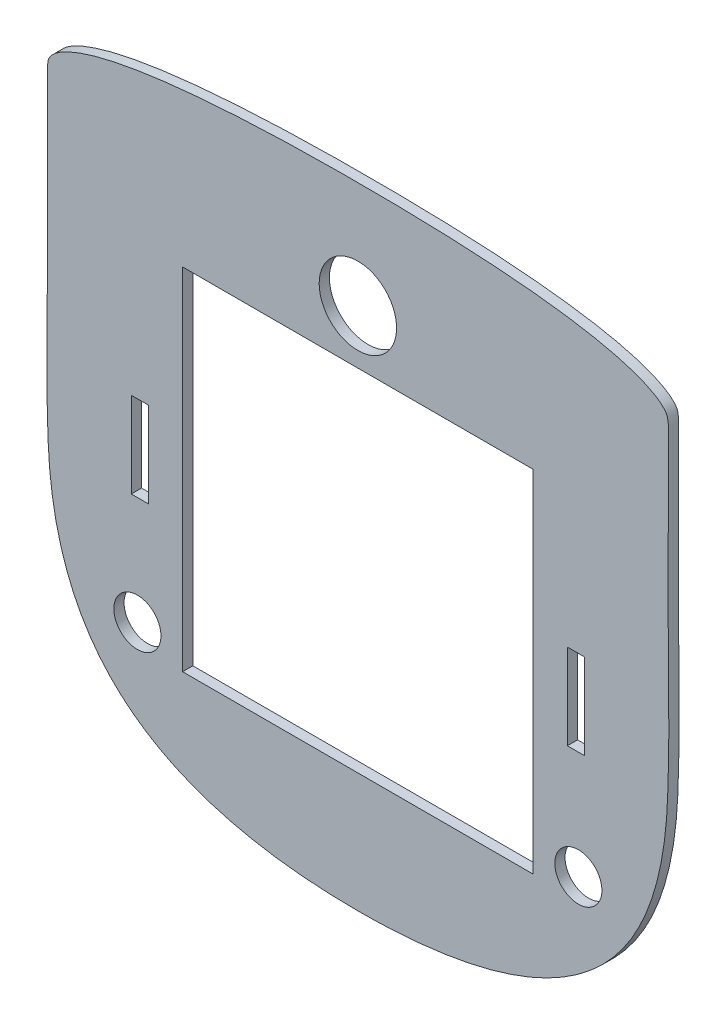
from build123d import *

# Parameters (mm, degrees)
SKETCH2_R           = 7
SKETCH2_W           = 5.08
SKETCH2_H           = 25.4
SKETCH2_R_2         = 11.5
BOSS_EXTRUDE1_DEPTH = 3.048
CUT_EXTRUDE1_DEPTH  = 41.402


with BuildPart() as part:
    # Sketch2 → Boss-Extrude1 (new body)
    with BuildSketch(Plane(origin=(-0.201743714, -72.235465767, -2871.297081617), x_dir=(1, 0, 0), z_dir=(0, 0, 1))):
        with BuildLine():
            add(Edge.make_bspline(
                [(98.004062475, 101.157461169), (98.09262319, 100.582578169), (98.168282436, 99.850726468), (98.201035971, 98.964297447), (98.205576946, 98.520375047), (98.203312676, 98.076151584), (98.2036357, 97.631790351), (98.202558859, 97.187198741), (98.201774618, 96.594166212), (98.199727801, 95.555659629), (98.196350571, 94.070122586), (98.191219577, 92.28435558), (98.185300348, 90.49549016), (98.178622099, 88.703544032), (98.171344138, 86.908538509), (98.163557432, 85.110493402), (98.155396592, 83.309431675), (98.146977163, 81.505376018), (98.135573428, 79.096007637), (98.121287428, 76.076928858), (98.105071958, 72.442435741), (98.090760178, 68.796539176), (98.079583302, 65.139438492), (98.072772264, 61.471337421), (98.071088324, 57.79245144), (98.075293125, 54.103000287), (98.087402852, 50.403265868), (98.10943536, 46.693533793), (98.149097734, 41.734317266), (98.212450561, 35.511894369), (98.259787617, 28.010008132), (98.250221769, 21.731245728), (98.193919112, 16.694316231), (98.134491312, 13.540940961), (98.069931219, 11.015367159), (98.012479287, 9.119948631), (97.944993251, 7.223485327), (97.867530353, 5.326182094), (97.778046924, 3.42822235), (97.678623521, 1.529831063), (97.562359374, -0.368849117), (97.273887049, -4.165889382), (96.636661612, -9.85760728), (95.264266353, -17.392207333), (93.283204663, -24.816906824), (90.614186019, -32.040137569), (87.187668119, -38.958467556), (83.676565473, -44.359852554), (80.486245723, -48.402543782), (77.054491026, -52.240907458), (72.331970353, -56.627334171), (66.103033739, -61.188185381), (59.428677872, -65.046681648), (52.43241755, -68.244481021), (45.195675565, -70.831968561), (37.797306155, -72.863270501), (30.289713623, -74.393153681), (22.727531896, -75.494270646), (12.612681112, -76.462699086), (5.032383013, -76.714841356), (-5.035467708, -76.714845104), (-12.619786852, -76.462418803), (-22.738781506, -75.493068818), (-30.303459175, -74.391002905), (-37.812929796, -72.859918013), (-45.212549357, -70.8271864), (-52.449882097, -68.238039152), (-59.446050161, -65.038426839), (-66.11960737, -61.178042376), (-72.347079086, -56.615416709), (-77.067892297, -52.227754271), (-80.498089265, -48.388656373), (-83.686768813, -44.345422026), (-87.195743233, -38.943757554), (-90.61986046, -32.025747475), (-93.286817212, -24.803397784), (-95.266250936, -17.379993897), (-96.637448669, -9.846957631), (-97.274071314, -4.156518411), (-97.562243264, -0.360344948), (-97.678371151, 1.537899747), (-97.777873142, 3.435856699), (-97.867367387, 5.333384926), (-97.944866703, 7.230259477), (-98.01237118, 9.126297729), (-98.069845849, 11.021295221), (-98.134428193, 13.546313761), (-98.193879205, 16.699007643), (-98.250205894, 21.73487995), (-98.259784562, 28.01239372), (-98.21244762, 35.512930688), (-98.149088971, 41.734380411), (-98.109425083, 46.69292327), (-98.087392785, 50.402205892), (-98.075284257, 54.10154993), (-98.071081296, 57.790672769), (-98.072767321, 61.469295328), (-98.079580473, 65.137200586), (-98.090759277, 68.794175587), (-98.10507262, 72.440018947), (-98.121289158, 76.074533479), (-98.135575612, 79.093693997), (-98.146979553, 81.503167019), (-98.155398915, 83.307320997), (-98.163559853, 85.108501066), (-98.171346036, 86.906684767), (-98.178624384, 88.70184922), (-98.185301078, 90.493974969), (-98.19122227, 92.28304054), (-98.196348387, 94.069029013), (-98.19973362, 95.554767419), (-98.201767603, 96.593425349), (-98.202574021, 97.186545216), (-98.203601448, 97.631207844), (-98.203365989, 98.075631059), (-98.205614022, 98.519942912), (-98.200956032, 98.963909964), (-98.168457073, 99.850519984), (-98.092668955, 100.58248079), (-97.911826163, 101.756705998), (-97.591091313, 102.927189457), (-96.744501402, 104.523718023), (-95.628370708, 105.930697933), (-94.324169919, 107.14983424), (-92.908919976, 108.210412347), (-90.919547633, 109.448243636), (-88.32196599, 110.731146164), (-85.128922247, 111.980994275), (-81.907009003, 113.019085815), (-78.679652448, 113.899326262), (-75.458556986, 114.656106392), (-72.248323156, 115.314989419), (-69.051267541, 115.893006101), (-65.867703019, 116.403620435), (-62.697382089, 116.855995394), (-59.54006886, 117.258606965), (-55.346025805, 117.736366707), (-50.130480964, 118.237811213), (-43.904887694, 118.718293109), (-37.698280921, 119.100136152), (-31.497185994, 119.401363035), (-25.286074462, 119.631882756), (-19.049652571, 119.802550798), (-10.6782592, 119.95730558), (-4.311359032, 120), (4.311566967, 120), (10.678373272, 119.957301971), (19.049194344, 119.802559271), (25.285019509, 119.631912924), (31.495423882, 119.401431783), (37.695748902, 119.100264796), (43.901569172, 118.718504865), (50.126405995, 118.238134551), (55.341386835, 117.736807508), (59.535046852, 117.259158056), (62.692115597, 116.856637797), (65.862243647, 116.404363117), (69.04567768, 115.893856369), (72.242677523, 115.315956677), (75.452943985, 114.657195729), (78.674177119, 113.900542139), (81.901794523, 113.020426463), (85.124114848, 111.98245115), (88.317738818, 110.73269729), (90.915977188, 109.449832), (92.905995487, 108.211972862), (94.321790196, 107.151328604), (95.626592976, 105.93205679), (96.74337158, 104.52484085), (97.59061533, 102.927904772), (97.911707231, 101.756975983), (98.004062475, 101.157461169)],
                knots=[0, 0, 0, 0, 0.00256774, 0.003209675, 0.00385161, 0.004493545, 0.00513548, 0.005777415, 0.00641935, 0.00770322, 0.010270959, 0.012838699, 0.015406439, 0.017974179, 0.020541919, 0.023109659, 0.025677399, 0.028245138, 0.030812878, 0.035948358, 0.041083838, 0.046219318, 0.051354797, 0.056490277, 0.061625757, 0.066761236, 0.071896716, 0.077032196, 0.082167676, 0.092438635, 0.102709594, 0.112980554, 0.118116034, 0.123251513, 0.125819253, 0.128386993, 0.130954733, 0.133522473, 0.136090213, 0.138657953, 0.141225692, 0.143793432, 0.154064392, 0.164335351, 0.174606311, 0.18487727, 0.19514823, 0.205419189, 0.210554669, 0.215690148, 0.225961108, 0.236232067, 0.246503027, 0.256773986, 0.267044946, 0.277315905, 0.287586865, 0.297857824, 0.308128783, 0.328670702, 0.328670702, 0.349206929, 0.359475043, 0.369743156, 0.38001127, 0.390279383, 0.400547497, 0.41081561, 0.421083724, 0.431351837, 0.441619951, 0.446754008, 0.451888064, 0.462156178, 0.472424291, 0.482692405, 0.492960518, 0.503228632, 0.513496745, 0.516063774, 0.518630802, 0.521197831, 0.523764859, 0.526331887, 0.528898916, 0.531465944, 0.534032972, 0.539167029, 0.544301086, 0.554569199, 0.564837313, 0.575105426, 0.580239483, 0.58537354, 0.590507597, 0.595641653, 0.60077571, 0.605909767, 0.611043824, 0.61617788, 0.621311937, 0.626445994, 0.629013022, 0.631580051, 0.634147079, 0.636714107, 0.639281136, 0.641848164, 0.644415193, 0.646982221, 0.649549249, 0.650832764, 0.651474521, 0.652116278, 0.652758035, 0.653399792, 0.654041549, 0.654683306, 0.657250335, 0.657250335, 0.659928039, 0.662605744, 0.665283448, 0.667961153, 0.670638857, 0.673316562, 0.678671971, 0.68402738, 0.68938279, 0.694738199, 0.700093608, 0.705449017, 0.710804426, 0.716159836, 0.721515245, 0.726870654, 0.732226063, 0.742936882, 0.7536477, 0.764358518, 0.775069337, 0.785780155, 0.796490973, 0.807201792, 0.828623429, 0.828623429, 0.8500455, 0.860756536, 0.871467571, 0.882178607, 0.892889643, 0.903600679, 0.914311714, 0.92502275, 0.930378268, 0.935733786, 0.941089304, 0.946444821, 0.951800339, 0.957155857, 0.962511375, 0.967866893, 0.973222411, 0.978577929, 0.983933446, 0.986611205, 0.989288964, 0.991966723, 0.994644482, 0.997322241, 1, 1, 1, 1], degree=3))
        make_face()
        with Locations((-65.5, -30.887752409)):
            Circle(SKETCH2_R, mode=Mode.SUBTRACT)
        with Locations((-64.77000195, 13.912247591)):
            Rectangle(SKETCH2_W, SKETCH2_H, mode=Mode.SUBTRACT)
        Polygon((0, 67.252247902), (52.07, 67.252248214), (52.070001625, -36.887752409), (-52.07000195, -36.887752409), (-52.07000195, 67.252247591), align=None, mode=Mode.SUBTRACT)
        with Locations((65.5, -30.887752409)):
            Circle(SKETCH2_R, mode=Mode.SUBTRACT)
        with Locations((64.77000195, 13.912247591)):
            Rectangle(SKETCH2_W, SKETCH2_H, mode=Mode.SUBTRACT)
        with Locations((0, 83.287247591)):
            Circle(SKETCH2_R_2, mode=Mode.SUBTRACT)
    extrude(amount=BOSS_EXTRUDE1_DEPTH)

    # Sketch8 → Cut-Extrude1 (cut)
    with BuildSketch(Plane(origin=(0, 0, -2871.297081617), x_dir=(-1, 0, 0), z_dir=(0, 0, -1))):
        with BuildLine():
            add(Edge.make_bspline(
                [(-97.802318762, 28.921995402), (-97.890879476, 28.347112402), (-97.966538722, 27.615260701), (-97.999292258, 26.72883168), (-98.003833232, 26.28490928), (-98.001568962, 25.840685818), (-98.001891986, 25.396324584), (-98.000815145, 24.951732974), (-98.000030904, 24.358700446), (-97.997984087, 23.320193862), (-97.994606857, 21.834656819), (-97.989475863, 20.048889814), (-97.983556634, 18.260024394), (-97.976878385, 16.468078265), (-97.969600424, 14.673072742), (-97.961813718, 12.875027636), (-97.953652879, 11.073965908), (-97.945233449, 9.269910252), (-97.933829714, 6.860541871), (-97.919543714, 3.841463091), (-97.903328244, 0.206969974), (-97.889016464, -3.438926591), (-97.877839588, -7.096027275), (-97.87102855, -10.764128346), (-97.86934461, -14.443014327), (-97.873549411, -18.13246548), (-97.885659138, -21.832199899), (-97.907691646, -25.541931973), (-97.947354021, -30.501148501), (-98.010706847, -36.723571398), (-98.058043903, -44.225457635), (-98.048478055, -50.504220038), (-97.992175398, -55.541149536), (-97.932747598, -58.694524805), (-97.868187505, -61.220098607), (-97.810735573, -63.115517135), (-97.743249537, -65.01198044), (-97.665786639, -66.909283673), (-97.57630321, -68.807243416), (-97.476879807, -70.705634704), (-97.36061566, -72.604314884), (-97.072143335, -76.401355149), (-96.434917898, -82.093073046), (-95.062522639, -89.6276731), (-93.08146095, -97.052372591), (-90.412442305, -104.275603335), (-86.985924405, -111.193933323), (-83.474821759, -116.595318321), (-80.284502009, -120.638009549), (-76.852747312, -124.476373225), (-72.130226639, -128.862799937), (-65.901290026, -133.423651148), (-59.226934158, -137.282147414), (-52.230673836, -140.479946788), (-44.993931851, -143.067434327), (-37.595562441, -145.098736268), (-30.087969909, -146.628619448), (-22.525788182, -147.729736413), (-12.410937398, -148.698164853), (-4.830639299, -148.950307123), (5.237211422, -148.950310871), (12.821530566, -148.697884569), (22.94052522, -147.728534585), (30.505202888, -146.626468672), (38.01467351, -145.09538378), (45.414293071, -143.062652167), (52.651625811, -140.473504918), (59.647793875, -137.273892606), (66.321351084, -133.413508142), (72.5488228, -128.850882476), (77.269636011, -124.463220038), (80.699832979, -120.624122139), (83.888512527, -116.580887793), (87.397486947, -111.17922332), (90.821604174, -104.261213242), (93.488560926, -97.038863551), (95.46799465, -89.615459663), (96.839192383, -82.082423398), (97.475815028, -76.391984177), (97.763986978, -72.595810715), (97.880114865, -70.69756602), (97.979616856, -68.799609067), (98.069111101, -66.902080841), (98.146610416, -65.00520629), (98.214114894, -63.109168038), (98.271589563, -61.214170545), (98.336171907, -58.689152006), (98.395622919, -55.536458124), (98.451949608, -50.500585817), (98.461528276, -44.223072047), (98.414191334, -36.722535078), (98.350832684, -30.501085356), (98.311168797, -25.542542497), (98.289136499, -21.833259874), (98.277027971, -18.133915836), (98.27282501, -14.444792997), (98.274511034, -10.766170439), (98.281324187, -7.09826518), (98.292502991, -3.44129018), (98.306816334, 0.20455318), (98.323032872, 3.839067712), (98.337319326, 6.85822823), (98.348723267, 9.267701252), (98.357142629, 11.07185523), (98.365303567, 12.873035299), (98.37308975, 14.671219), (98.380368097, 16.466383454), (98.387044792, 18.258509202), (98.392965984, 20.047574773), (98.398092101, 21.833563247), (98.401477334, 23.319301652), (98.403511317, 24.357959583), (98.404317734, 24.951079449), (98.405345162, 25.395742077), (98.405109703, 25.840165292), (98.407357735, 26.284477146), (98.402699746, 26.728444197), (98.370200787, 27.615054217), (98.294412669, 28.347015023), (98.113569876, 29.521240231), (97.792835026, 30.69172369), (96.946245115, 32.288252256), (95.830114422, 33.695232166), (94.525913633, 34.914368473), (93.11066369, 35.974946581), (91.121291347, 37.21277787), (88.523709704, 38.495680397), (85.330665961, 39.745528508), (82.108752716, 40.783620049), (78.881396161, 41.663860496), (75.6603007, 42.420640625), (72.45006687, 43.079523652), (69.253011254, 43.657540334), (66.069446732, 44.168154669), (62.899125803, 44.620529627), (59.741812573, 45.023141198), (55.547769519, 45.50090094), (50.332224678, 46.002345447), (44.106631408, 46.482827342), (37.900024635, 46.864670385), (31.698929708, 47.165897269), (25.487818176, 47.39641699), (19.251396285, 47.567085031), (10.880002913, 47.721839814), (4.513102746, 47.764534233), (-4.109823253, 47.764534233), (-10.476629559, 47.721836204), (-18.84745063, 47.567093504), (-25.083275795, 47.396447158), (-31.293680168, 47.165966016), (-37.494005188, 46.864799029), (-43.699825458, 46.483039098), (-49.924662281, 46.002668784), (-55.139643121, 45.501341742), (-59.333303138, 45.02369229), (-62.490371883, 44.62117203), (-65.660499933, 44.16889735), (-68.843933966, 43.658390602), (-72.040933809, 43.08049091), (-75.251200271, 42.421729962), (-78.472433405, 41.665076372), (-81.700050809, 40.784960696), (-84.922371134, 39.746985383), (-88.115995104, 38.497231523), (-90.714233474, 37.214366233), (-92.704251774, 35.976507095), (-94.120046482, 34.915862837), (-95.424849262, 33.696591023), (-96.541627866, 32.289375083), (-97.388871616, 30.692439005), (-97.709963517, 29.521510216), (-97.802318762, 28.921995402)],
                knots=[0, 0, 0, 0, 0.00256774, 0.003209675, 0.00385161, 0.004493545, 0.00513548, 0.005777415, 0.00641935, 0.00770322, 0.010270959, 0.012838699, 0.015406439, 0.017974179, 0.020541919, 0.023109659, 0.025677399, 0.028245138, 0.030812878, 0.035948358, 0.041083838, 0.046219318, 0.051354797, 0.056490277, 0.061625757, 0.066761236, 0.071896716, 0.077032196, 0.082167676, 0.092438635, 0.102709594, 0.112980554, 0.118116034, 0.123251513, 0.125819253, 0.128386993, 0.130954733, 0.133522473, 0.136090213, 0.138657953, 0.141225692, 0.143793432, 0.154064392, 0.164335351, 0.174606311, 0.18487727, 0.19514823, 0.205419189, 0.210554669, 0.215690148, 0.225961108, 0.236232067, 0.246503027, 0.256773986, 0.267044946, 0.277315905, 0.287586865, 0.297857824, 0.308128783, 0.328670702, 0.328670702, 0.349206929, 0.359475043, 0.369743156, 0.38001127, 0.390279383, 0.400547497, 0.41081561, 0.421083724, 0.431351837, 0.441619951, 0.446754008, 0.451888064, 0.462156178, 0.472424291, 0.482692405, 0.492960518, 0.503228632, 0.513496745, 0.516063774, 0.518630802, 0.521197831, 0.523764859, 0.526331887, 0.528898916, 0.531465944, 0.534032972, 0.539167029, 0.544301086, 0.554569199, 0.564837313, 0.575105426, 0.580239483, 0.58537354, 0.590507597, 0.595641653, 0.60077571, 0.605909767, 0.611043824, 0.61617788, 0.621311937, 0.626445994, 0.629013022, 0.631580051, 0.634147079, 0.636714107, 0.639281136, 0.641848164, 0.644415193, 0.646982221, 0.649549249, 0.650832764, 0.651474521, 0.652116278, 0.652758035, 0.653399792, 0.654041549, 0.654683306, 0.657250335, 0.657250335, 0.659928039, 0.662605744, 0.665283448, 0.667961153, 0.670638857, 0.673316562, 0.678671971, 0.68402738, 0.68938279, 0.694738199, 0.700093608, 0.705449017, 0.710804426, 0.716159836, 0.721515245, 0.726870654, 0.732226063, 0.742936882, 0.7536477, 0.764358518, 0.775069337, 0.785780155, 0.796490973, 0.807201792, 0.828623429, 0.828623429, 0.8500455, 0.860756536, 0.871467571, 0.882178607, 0.892889643, 0.903600679, 0.914311714, 0.92502275, 0.930378268, 0.935733786, 0.941089304, 0.946444821, 0.951800339, 0.957155857, 0.962511375, 0.967866893, 0.973222411, 0.978577929, 0.983933446, 0.986611205, 0.989288964, 0.991966723, 0.994644482, 0.997322241, 1, 1, 1, 1], degree=3))
        make_face()
        with BuildLine():
            add(Edge.make_bspline(
                [(0.201743522, -144.623319731), (-3.274536304, -144.623319865), (-6.738547743, -144.537415239), (-13.639117858, -144.17337837), (-17.075885232, -143.896707457), (-23.917176856, -143.117595306), (-27.321713607, -142.615241598), (-34.091569015, -141.335924274), (-37.456790771, -140.558282134), (-42.467583889, -139.132463684), (-44.131958582, -138.613639953), (-47.445143032, -137.476320327), (-49.079136574, -136.862852677), (-53.907042783, -134.875577699), (-57.027450589, -133.356027639), (-61.530249164, -130.724141208), (-63.001395544, -129.787786199), (-65.157935979, -128.283760343), (-65.868579212, -127.765607018), (-67.258794227, -126.705614731), (-67.940144477, -126.162576337), (-71.27754047, -123.381633721), (-73.725197711, -120.946171591), (-77.049028104, -116.96339166), (-78.099695644, -115.581499232), (-79.589134787, -113.426597328), (-80.072068485, -112.693245508), (-81.004897857, -111.205414168), (-81.453226985, -110.453556275), (-83.607344907, -106.655829248), (-85.05323229, -103.495825112), (-86.875348272, -98.603559912), (-87.424591436, -96.947277726), (-88.168216421, -94.427617375), (-88.402634024, -93.581952361), (-88.843052793, -91.891169187), (-89.049511593, -91.044543362), (-90.017851718, -86.805673806), (-90.589625027, -83.396366179), (-91.214815991, -78.261538564), (-91.3840958, -76.546418242), (-91.654496844, -73.110059757), (-91.754016272, -71.388677816), (-91.898041054, -67.94097593), (-91.953937652, -66.21567845), (-92.047124571, -62.763413411), (-92.082532425, -61.036276883), (-92.216452156, -52.396723879), (-92.18174868, -45.471992609), (-92.088776017, -35.090783444), (-92.050582828, -31.630433758), (-91.989104785, -24.709623916), (-91.967343228, -21.249135437), (-91.935387884, -10.86768894), (-91.950845684, -3.946701754), (-91.989167962, 6.434762218), (-92.005223842, 9.895238506), (-92.030335068, 16.816216046), (-92.042022057, 20.276707913), (-92.052491789, 24.169770815), (-92.053737389, 24.602325411), (-92.055319228, 25.251182986), (-92.056417151, 25.467506003), (-92.057189797, 25.900059362), (-92.057095442, 26.116304741), (-92.02698149, 26.763098356), (-91.978779879, 27.19246262), (-91.889344649, 27.727267604), (-91.870064381, 27.83414662), (-91.828925375, 28.047701464), (-91.808160197, 28.154405584), (-91.726988406, 28.467446667), (-91.65227417, 28.66842382), (-91.468917245, 29.057668114), (-91.359394128, 29.247447264), (-91.11804123, 29.606368595), (-90.986480026, 29.776462145), (-90.568248072, 30.266477752), (-90.256757384, 30.567894605), (-89.601419654, 31.129549974), (-89.259792729, 31.387452268), (-88.557956958, 31.872737011), (-88.197767155, 32.100150737), (-87.096730457, 32.748775452), (-86.335064825, 33.135792743), (-84.777268278, 33.853219879), (-83.986925551, 34.179530259), (-81.601253499, 35.088514112), (-79.986643693, 35.603747797), (-76.729369531, 36.528837706), (-75.086341974, 36.937329685), (-71.780252186, 37.679060145), (-70.117182339, 38.012270017), (-66.776153116, 38.622762265), (-65.097074445, 38.899741463), (-61.737301209, 39.407885048), (-60.055411866, 39.639429545), (-55.004811485, 40.27858234), (-51.631273297, 40.631893297), (-44.8751476, 41.236725519), (-41.492474378, 41.487282667), (-31.334002379, 42.121382869), (-24.544052969, 42.389307732), (-10.974643961, 42.717803017), (-4.192330738, 42.777909329), (9.368637658, 42.738812197), (16.147215028, 42.636220411), (29.699167251, 42.204464881), (36.472601324, 41.877880212), (46.62672232, 41.125389049), (50.010405342, 40.829964018), (56.775001058, 40.118464923), (60.149502258, 39.703179825), (66.874429576, 38.697267592), (70.226685679, 38.108245128), (75.205795664, 37.005329061), (76.859061013, 36.599674154), (80.133291379, 35.682509559), (81.75724986, 35.171544533), (84.146014914, 34.277014131), (84.933113097, 33.957970061), (86.481394857, 33.260825802), (87.244594757, 32.883160796), (88.72406713, 32.039193106), (89.437776152, 31.578598492), (90.431586847, 30.773845288), (90.748830719, 30.486610048), (91.184220302, 30.020992011), (91.322848846, 29.859654122), (91.582701428, 29.520562866), (91.703496358, 29.342864518), (91.914884307, 28.975434703), (92.006759063, 28.784977768), (92.118252687, 28.486452265), (92.151015114, 28.38479609), (92.206584763, 28.17662686), (92.227506651, 28.071891945), (92.329344448, 27.548669314), (92.39159565, 27.128973088), (92.443543455, 26.497018498), (92.45523748, 26.286039897), (92.462017015, 25.863116448), (92.460346666, 25.651360338), (92.458083199, 25.016251853), (92.457289977, 24.592887837), (92.45093913, 22.475929022), (92.445997129, 20.782404301), (92.429509702, 15.701769956), (92.417556107, 12.314683849), (92.389510302, 5.540526499), (92.375801061, 2.153443402), (92.345673384, -8.00778177), (92.340360666, -14.781904332), (92.393318139, -24.942974536), (92.423417891, -28.32997472), (92.490213033, -35.103962787), (92.525899349, -38.491049624), (92.599380118, -48.650942063), (92.605139835, -55.422441517), (92.423350701, -63.879111689), (92.37698766, -65.57003786), (92.261788465, -68.950974084), (92.19632998, -70.641121827), (91.893906299, -75.707241991), (91.568112557, -79.079593307), (90.837153692, -84.128244194), (90.552935949, -85.809474195), (89.891323681, -89.168135838), (89.515906538, -90.834550134), (88.244354253, -95.779057782), (87.202473146, -99.007446467), (85.285940995, -103.726254701), (84.587996215, -105.278509513), (83.44261575, -107.572436225), (83.043626428, -108.332733268), (82.214469653, -109.834639411), (81.785650062, -110.57381334), (79.570074017, -114.210562237), (77.570688207, -116.932267832), (74.224079389, -120.727378139), (73.04987121, -121.943886373), (71.201237497, -123.696423665), (70.570511353, -124.268597235), (69.280049641, -125.388950185), (68.618635142, -125.938410226), (65.262197027, -128.607702982), (62.426605155, -130.48902916), (57.983597367, -132.990734487), (56.471068344, -133.771385502), (54.158695701, -134.868753278), (53.380631714, -135.222257654), (51.810471978, -135.905565591), (51.018390834, -136.23530376), (47.049358743, -137.817468481), (43.826477644, -138.880572429), (37.306563581, -140.691491332), (34.009381997, -141.438674363), (27.353837442, -142.672901073), (23.995657139, -143.16072145), (18.919984401, -143.729167953), (17.220737046, -143.891322706), (13.822843435, -144.164632358), (12.122727142, -144.276152944), (8.720321786, -144.452497738), (7.018028553, -144.517232289), (4.463051204, -144.581290722), (3.185178094, -144.605057776), (1.693674208, -144.618775071), (0.94776185, -144.622186153), (0.628051025, -144.622915154), (0.414902926, -144.62323894), (0.310377266, -144.623319727), (0.201743522, -144.623319731)],
                knots=[0, 0, 0, 0, 0.015625, 0.015625, 0.03125, 0.03125, 0.046875, 0.046875, 0.0625, 0.0625, 0.0703125, 0.0703125, 0.078125, 0.078125, 0.09375, 0.09375, 0.1015625, 0.1015625, 0.10546875, 0.10546875, 0.109375, 0.109375, 0.125, 0.125, 0.1328125, 0.1328125, 0.13671875, 0.13671875, 0.140625, 0.140625, 0.15625, 0.15625, 0.1640625, 0.1640625, 0.16796875, 0.16796875, 0.171875, 0.171875, 0.1875, 0.1875, 0.1953125, 0.1953125, 0.203125, 0.203125, 0.2109375, 0.2109375, 0.21875, 0.21875, 0.25, 0.25, 0.265625, 0.265625, 0.28125, 0.28125, 0.3125, 0.3125, 0.328125, 0.328125, 0.34375, 0.34375, 0.345703125, 0.345703125, 0.346679688, 0.346679688, 0.34765625, 0.34765625, 0.349609375, 0.349609375, 0.350097656, 0.350097656, 0.350585938, 0.350585938, 0.3515625, 0.3515625, 0.352539062, 0.352539062, 0.353515625, 0.353515625, 0.35546875, 0.35546875, 0.357421875, 0.357421875, 0.359375, 0.359375, 0.36328125, 0.36328125, 0.3671875, 0.3671875, 0.375, 0.375, 0.3828125, 0.3828125, 0.390625, 0.390625, 0.3984375, 0.3984375, 0.40625, 0.40625, 0.421875, 0.421875, 0.4375, 0.4375, 0.46875, 0.46875, 0.5, 0.5, 0.53125, 0.53125, 0.5625, 0.5625, 0.578125, 0.578125, 0.59375, 0.59375, 0.609375, 0.609375, 0.6171875, 0.6171875, 0.625, 0.625, 0.62890625, 0.62890625, 0.6328125, 0.6328125, 0.63671875, 0.63671875, 0.638671875, 0.638671875, 0.639648437, 0.639648437, 0.640625, 0.640625, 0.641601562, 0.641601562, 0.642089844, 0.642089844, 0.642578125, 0.642578125, 0.64453125, 0.64453125, 0.645507812, 0.645507812, 0.646484375, 0.646484375, 0.6484375, 0.6484375, 0.65625, 0.65625, 0.671875, 0.671875, 0.6875, 0.6875, 0.71875, 0.71875, 0.734375, 0.734375, 0.75, 0.75, 0.78125, 0.78125, 0.7890625, 0.7890625, 0.796875, 0.796875, 0.8125, 0.8125, 0.8203125, 0.8203125, 0.828125, 0.828125, 0.84375, 0.84375, 0.8515625, 0.8515625, 0.85546875, 0.85546875, 0.859375, 0.859375, 0.875, 0.875, 0.8828125, 0.8828125, 0.88671875, 0.88671875, 0.890625, 0.890625, 0.90625, 0.90625, 0.9140625, 0.9140625, 0.91796875, 0.91796875, 0.921875, 0.921875, 0.9375, 0.9375, 0.953125, 0.953125, 0.96875, 0.96875, 0.9765625, 0.9765625, 0.984375, 0.984375, 0.9921875, 0.9921875, 0.99609375, 0.998046875, 0.999023438, 0.999511719, 0.999511719, 1, 1, 1, 1], degree=3))
        make_face(mode=Mode.SUBTRACT)
    extrude(amount=-CUT_EXTRUDE1_DEPTH, mode=Mode.SUBTRACT)


solid = part.part
